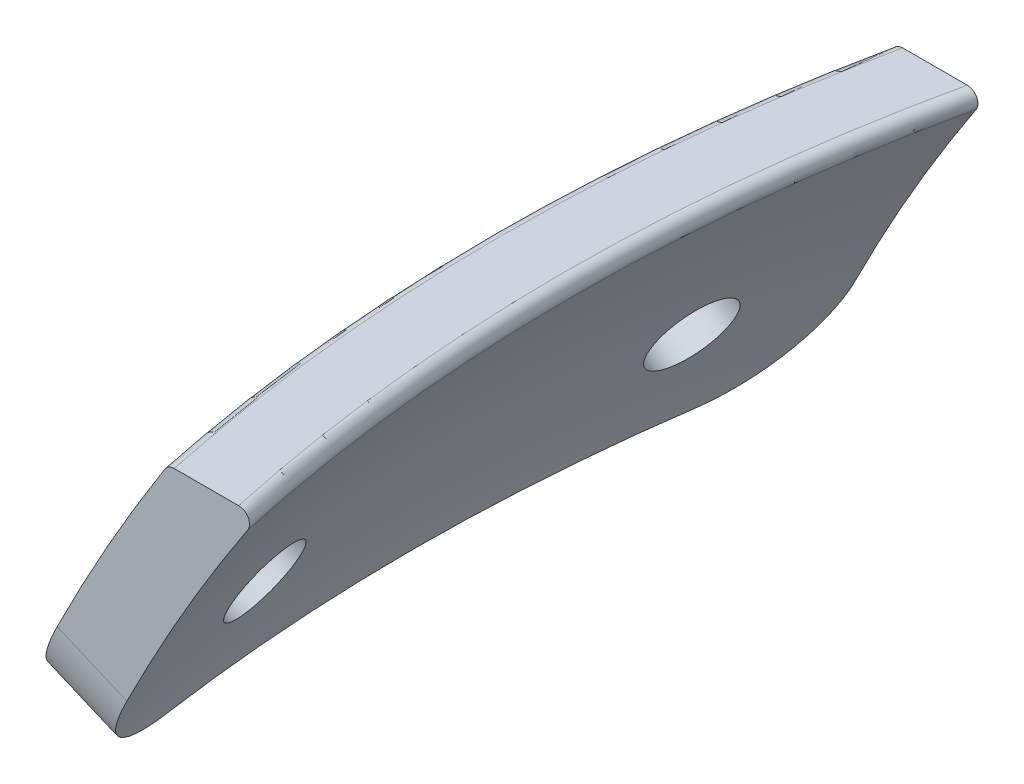
from build123d import *

# Parameters (mm, degrees)
REVOLVE1_ANGLE      = 25
SKETCH5_OUTSIDE_W   = 45.757
SKETCH5_OUTSIDE_H   = 97.796
SKETCH5_OUTSIDE_W_2 = 46.977293773
SKETCH5_OUTSIDE_H_2 = 68.531798408
CUT_EXTRUDE2_DEPTH  = 269.530027711
FILLET1_R           = 10
FILLET2_R           = 1


with BuildPart() as part:
    # Sketch1 → Revolve1 (revolve, symmetric)
    with BuildSketch(Plane.XY) as revolve1_sk:
        with BuildLine():
            Line((-166.646098372, 194.668503093), (-158.316209222, 194.668503093))
            ThreePointArc((-158.316209222, 194.668503093), (-160.562637909, 191.192574346), (-162.732763317, 187.668503093))
            ThreePointArc((-162.732763317, 187.668503093), (-168.922383074, 176.537942212), (-174.351818471, 165.017438338))
            Line((-174.351818471, 165.017438338), (-180.780381701, 167.787560139))
            ThreePointArc((-180.780381701, 167.787560139), (-174.232419594, 181.501021703), (-166.646098372, 194.668503093))
        make_face()
    revolve(axis=Axis((0, 0, 0), (0, 1, 0)), revolution_arc=REVOLVE1_ANGLE / 2)
    revolve(revolve1_sk.sketch, axis=Axis((0, 0, 0), (0, -1, 0)), revolution_arc=REVOLVE1_ANGLE / 2)

    # Sketch4 → Cut-Revolve1 (revolve, cut)
    with BuildSketch(Plane(origin=(36.360369904, 71.361243959, 0), x_dir=(-0.8910065241883692, 0.45399049973954425, 0), z_dir=(0.45399049973954425, 0.8910065241883692, 0))):
        Polygon((219.544590506, 23.072369182), (238.812878652, 24.758125961), (239.148428262, 20.922776373), (219.880140115, 19.237019595), align=None)
    cut_revolve1 = revolve(axis=Axis((-159.554269478, 171.184738652, 19.237019595), (-0.887615975361608, 0.4522629288245561, 0.08715574274765844)), mode=Mode.SUBTRACT)

    # Mirror1: Cut-Revolve1 across plane
    add(cut_revolve1.mirror(Plane.XY), mode=Mode.SUBTRACT)

    # Sketch5 outside → Cut-Extrude2 (cut, through all)
    with BuildSketch(Plane(origin=(0, 0, 0), x_dir=(1, 0, 0), z_dir=(0, 1, 0))):
        with Locations((-167.6715, 0)):
            Rectangle(SKETCH5_OUTSIDE_W, SKETCH5_OUTSIDE_H)
        with Locations((-178.052129813, 0)):
            Rectangle(SKETCH5_OUTSIDE_W_2, SKETCH5_OUTSIDE_H_2, mode=Mode.SUBTRACT)
    extrude(amount=CUT_EXTRUDE2_DEPTH, mode=Mode.SUBTRACT)

    # Fillet1
    fillet1_edges = [part.edges().sort_by_distance(p)[0] for p in [
        (-174.227520532, 166.402087732, -34.265899204),
        (-174.227520532, 166.402087732, 34.265899204),
    ]]
    fillet(fillet1_edges, radius=FILLET1_R)

    # Fillet2
    fillet2_edges = [part.edges().sort_by_distance(p)[0] for p in [
        (-166.646098372, 194.668503093, 0),
        (-158.316209222, 194.668503093, 0),
    ]]
    fillet(fillet2_edges, radius=FILLET2_R)


solid = part.part
